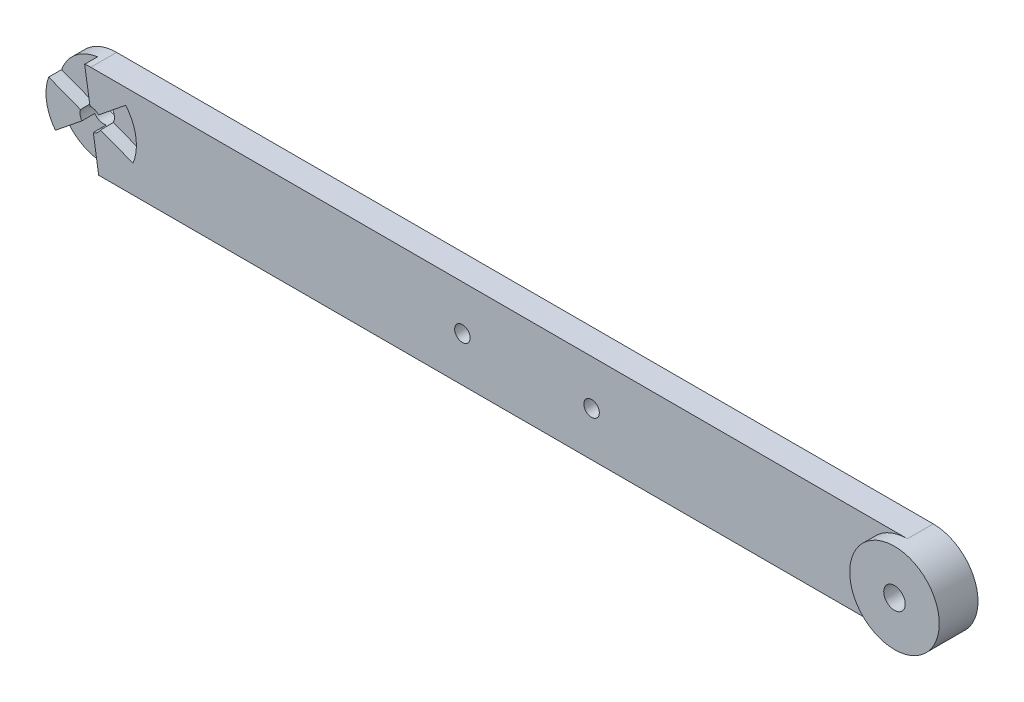
from build123d import *
from build123d.topology import SkipClean

# Parameters (mm, degrees)
SKETCH1_R            = 2.5
BOSS_EXTRUDE1_DEPTH  = 6
CUT_EXTRUDE3_DEPTH   = 3
BOSS_EXTRUDE2_START  = 3
SKETCH4_R            = 2.5
BOSS_EXTRUDE2_DEPTH  = 3
M3_CLEARANCE_HOLE1_D = 3.6


with BuildPart() as part:
    # Sketch1 → Boss-Extrude1 (new body)
    with BuildSketch(Plane.XY):
        with BuildLine():
            Line((0, -10.4), (189.7, -10.4))
            ThreePointArc((189.7, -10.4), (200.1, 0), (189.7, 10.4))
            Line((189.7, 10.4), (0, 10.4))
            ThreePointArc((0, 10.4), (-10.4, 0), (0, -10.4))
        make_face()
        Circle(SKETCH1_R, mode=Mode.SUBTRACT)
        with Locations((189.7, 0)):
            Circle(SKETCH1_R, mode=Mode.SUBTRACT)
    extrude(amount=BOSS_EXTRUDE1_DEPTH)

    # Sketch6 → Cut-Extrude3 (cut)
    with BuildSketch(Plane(origin=(0, 0, 0), x_dir=(-1, 0, 0), z_dir=(0, 0, -1))):
        with BuildLine():
            ThreePointArc((0.189684667, 2.492793559), (1.571265552, 1.944511395), (2.39740304, 0.708843186))
            Line((2.39740304, 0.708843186), (9.962077265, 3.621742201))
            ThreePointArc((9.962077265, 3.621742201), (6.66216594, 8.244728315), (1.449377234, 10.500443116))
            Line((1.449377234, 10.500443116), (0.189684667, 2.492793559))
        make_face()
        with BuildLine():
            ThreePointArc((2.063980215, -1.41066852), (0.89836349, -2.333011582), (-0.584825314, -2.430633529))
            Line((-0.584825314, -2.430633529), (-1.844517881, -10.438283086))
            ThreePointArc((-1.844517881, -10.438283086), (3.809061198, -9.891969106), (8.368961872, -6.505419062))
            Line((8.368961872, -6.505419062), (2.063980215, -1.41066852))
        make_face()
        with BuildLine():
            Line((-9.818339107, -3.995024054), (-2.253664882, -1.082125039))
            ThreePointArc((-2.253664882, -1.082125039), (-2.469629042, 0.388500187), (-1.812577726, 1.721790343))
            Line((-1.812577726, 1.721790343), (-8.117559384, 6.816540886))
            ThreePointArc((-8.117559384, 6.816540886), (-10.471227138, 1.647240791), (-9.818339107, -3.995024054))
        make_face()
    extrude(amount=-CUT_EXTRUDE3_DEPTH, mode=Mode.SUBTRACT)

    # Sketch4 → Boss-Extrude2 (add)
    with SkipClean():  # the faces are left unmerged after this step: merging them gives an invalid solid
        with BuildSketch(Plane(origin=(0, 0, 0), x_dir=(-1, 0, 0), z_dir=(0, 0, -1)).offset(BOSS_EXTRUDE2_START)):
            with BuildLine():
                ThreePointArc((-189.7, 10.4), (-200.1, 0), (-189.7, -10.4))
                ThreePointArc((-189.7, -10.4), (-179.3, 0), (-189.7, 10.4))
            make_face()
            with Locations((-189.7, 0)):
                Circle(SKETCH4_R, mode=Mode.SUBTRACT)
        extrude(amount=-BOSS_EXTRUDE2_DEPTH)


with BuildPart() as body_2:
    # Mirror1: mirrored copy
    add(part.part.mirror(Plane.XY))

    # M3 Clearance Hole1 (through all)
    with Locations(Plane(origin=(0, 0, -6), x_dir=(-1, 0, 0), z_dir=(0, 0, -1))):
        with Locations((-116.336074354, -0.050784287), (-86.336165629, 0.001543951)):
            Hole(M3_CLEARANCE_HOLE1_D / 2)


solid = body_2.part
